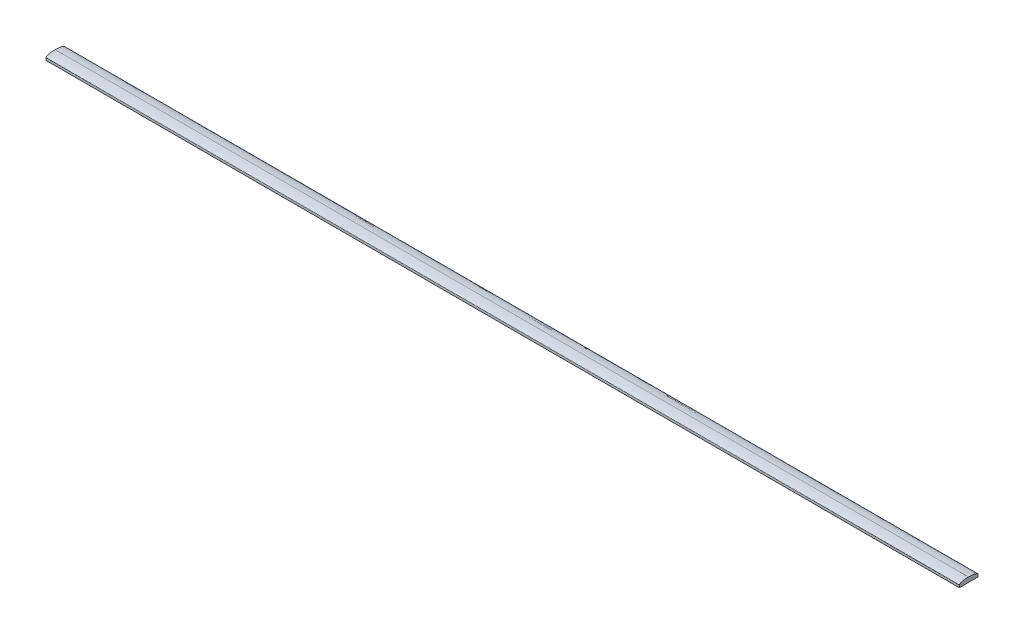
from build123d import *

# Parameters (mm, degrees)
SKETCH1_W           = 488.95
SKETCH1_H           = 10
BOSS_EXTRUDE1_DEPTH = 2.54
FILLET5_SIZE        = 1.27
FILLET5_SIZE_2      = 5.08


with BuildPart() as part:
    # Sketch1 → Boss-Extrude1 (new body)
    with BuildSketch(Plane(origin=(0, 0, 0), x_dir=(1, 0, 0), z_dir=(0, 1, 0))):
        with Locations((244.475, 5)):
            Rectangle(SKETCH1_W, SKETCH1_H)
    extrude(amount=BOSS_EXTRUDE1_DEPTH)

    # Fillet5
    # an asymmetric fillet: 5.08, 1.27 mm, written as the material it takes off along each edge
    with BuildSketch(Plane(origin=(501.65, 2.54, -10), x_dir=(0, -1, 0), z_dir=(-1, 0, 0)), Plane(origin=(-12.7, 2.54, 0), x_dir=(0, -1, 0), z_dir=(1, 0, 0))) as fillet5_piece_1:
        with BuildLine():
            Bezier((FILLET5_SIZE, 0), (0, 0), (0, FILLET5_SIZE_2), weights=[1, 0.707106781, 1])
            Line((0, FILLET5_SIZE_2), (0, 0))
            Line((0, 0), (FILLET5_SIZE, 0))
        make_face()
    extrude(amount=514.35, mode=Mode.SUBTRACT)


solid = part.part
